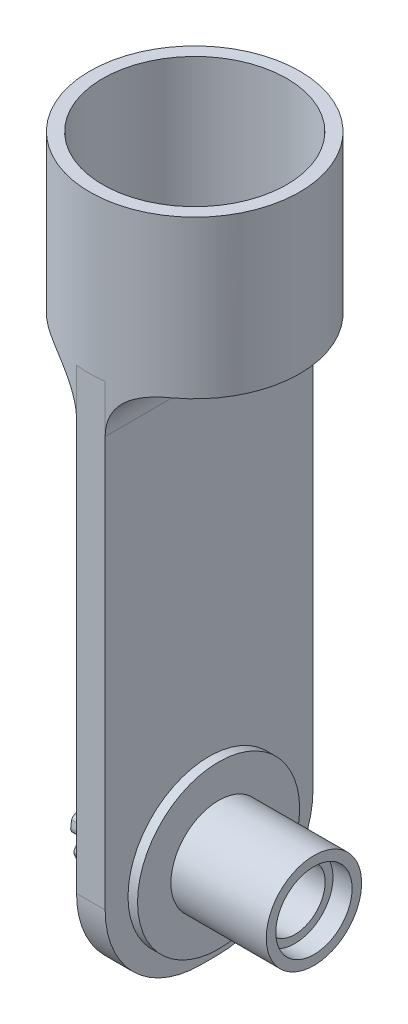
from build123d import *

# Parameters (mm, degrees)
SKETCH2_R                = 11
BOSS_EXTRUDE2_DEPTH      = 1.5
BOSS_EXTRUDE3_START      = -15
SKETCH3_R                = 11
SKETCH3_R_2              = 9.652
BOSS_EXTRUDE3_DEPTH      = 15
SKETCH4_W                = 3
SKETCH4_H                = 21.794494718
BOSS_EXTRUDE4_DEPTH      = 58
SKETCH11_R               = 8.5
BOSS_EXTRUDE11_DEPTH     = 1
SKETCH8_R                = 5
BOSS_EXTRUDE6_DEPTH      = 10
BOSS_EXTRUDE9_START      = 1
SKETCH17_R               = 8.5
BOSS_EXTRUDE9_DEPTH      = 1
SKETCH19_R               = 5.775
BOSS_EXTRUDE10_DEPTH     = 4.75
CUT_EXTRUDE5_DEPTH       = 4.75
FILLET3_R                = 0.5
CIRPATTERN2_COUNT        = 11
FILLET3_OF_CIRPATTERN2_R = 0.5
SKETCH15_R               = 3.175
ENCODER_BED_DEPTH        = 6
FILLET5_R                = 10
FILLET7_R                = 5
SKETCH21_R               = 4
CUT_EXTRUDE6_DEPTH       = 2


with BuildPart() as part:
    # Sketch2 → Boss-Extrude2 (new body)
    with BuildSketch(Plane(origin=(0, 0, 0), x_dir=(-1, 0, 0), z_dir=(0, 1, 0))):
        with Locations(Location((0, 0, 0), (0, 0, 90))):
            Circle(SKETCH2_R)
    extrude(amount=-BOSS_EXTRUDE2_DEPTH)

    # Sketch3 → Boss-Extrude3 (add)
    with BuildSketch(Plane(origin=(0, 0, 0), x_dir=(-1, 0, 0), z_dir=(0, -1, 0)).offset(BOSS_EXTRUDE3_START)):
        with Locations(Location((0, 0, 0), (0, 0, 270))):
            Circle(SKETCH3_R)
        with Locations(Location((0, 0, 0), (0, 0, 90))):
            Circle(SKETCH3_R_2, mode=Mode.SUBTRACT)
    extrude(amount=BOSS_EXTRUDE3_DEPTH)

    # Sketch4 → Boss-Extrude4 (add)
    with BuildSketch(Plane.XZ.offset(1.5)):
        Rectangle(SKETCH4_W, SKETCH4_H)
    extrude(amount=BOSS_EXTRUDE4_DEPTH)

    # Sketch11 → Boss-Extrude11 (add)
    with BuildSketch(Plane(origin=(1.5, 0, 0), x_dir=(0, 0, -1), z_dir=(1, 0, 0))):
        with Locations(Location((0, -49.5, 0), (0, 0, 180))):
            Circle(SKETCH11_R)
    extrude(amount=BOSS_EXTRUDE11_DEPTH)

    # Sketch8 → Boss-Extrude6 (add)
    with BuildSketch(Plane.ZY.offset(-2.5)):
        with Locations((0, -49.5)):
            Circle(SKETCH8_R)
    extrude(amount=-BOSS_EXTRUDE6_DEPTH)

    # Sketch17 → Boss-Extrude9 (add)
    with BuildSketch(Plane.ZY.offset(1.5).offset(BOSS_EXTRUDE9_START)):
        with Locations((0, -49.5)):
            Circle(SKETCH17_R)
    extrude(amount=-BOSS_EXTRUDE9_DEPTH)

    # Sketch19 → Boss-Extrude10 (add)
    with BuildSketch(Plane.ZY.offset(2.5)):
        with Locations((0, -49.5)):
            Circle(SKETCH19_R)
    extrude(amount=BOSS_EXTRUDE10_DEPTH)

    # Sketch14 → Cut-Extrude5 (cut)
    with BuildSketch(Plane.ZY.offset(2.5)):
        with BuildLine():
            Line((-0.25, -44.539224552), (-1, -43.812239017))
            ThreePointArc((-1, -43.812239017), (0, -43.725), (1, -43.812239017))
            Line((1, -43.812239017), (0.25, -44.539224552))
            ThreePointArc((0.25, -44.539224552), (0, -44.532929128), (-0.25, -44.539224552))
        make_face()
    cut_extrude5 = extrude(amount=CUT_EXTRUDE5_DEPTH, mode=Mode.SUBTRACT)

    # Fillet3
    # the kernel refuses this fillet: 0.5 mm, written as the material it adds along each edge
    with BuildSketch(Plane(origin=(-1.971938713, -44.539224552, -0.25), x_dir=(0, 0.030079948126667946, 0.9995474959804046), z_dir=(-1, 0, 0))) as fillet3_piece_1:
        with BuildLine():
            CenterArc((0.211467449, 0.499897303), FILLET3_R, 224.168999479, 44.669714596)
            Line((-0.147176406, 0.151508749), (0, 0))
            ThreePointArc((0, 0), (0.100667006, 0.001020208), (0.201334012, 0))
        make_face()
    extrude(amount=5.278061287)
    with BuildSketch(Plane(origin=(-1.971938713, -44.539224552, 0.25), x_dir=(0, 0.696004116807963, 0.7180377910572447), z_dir=(-1, 0, 0))) as fillet3_piece_2:
        with BuildLine():
            CenterArc((0.211224515, 0.5), FILLET3_R, 225.330285404, 44.669714596)
            ThreePointArc((-0.14028493, 0.144414413), (-0.069410683, 0.072918064), (0, 0))
            Line((0, 0), (0.211224515, 0))
        make_face()
    extrude(amount=5.278061287)
    # the kernel refuses this fillet: 0.5 mm, written as the material it takes off along each edge
    with BuildSketch(Plane(origin=(-2.5, -43.812239017, 1), x_dir=(0, -0.196537958792603, 0.9804962165932294), z_dir=(-1, 0, 0))) as fillet3_2_piece_1:
        with BuildLine():
            CenterArc((0.262836385, -0.499858535), FILLET3_R, 88.637028418, 56.804838909)
            Line((-0.148939157, -0.216237481), (0, 0))
            ThreePointArc((0, 0), (0.137364717, 0.001633916), (0.274729434, 0))
        make_face()
    extrude(amount=5.436823586, mode=Mode.SUBTRACT)
    with BuildSketch(Plane(origin=(-2.5, -43.812239017, -1), x_dir=(0, -0.19653795879262614, -0.9804962165932248), z_dir=(-1, 0, 0))) as fillet3_2_piece_2:
        with BuildLine():
            CenterArc((0.262836385, 0.499858535), FILLET3_R, 214.558132673, 56.804838909)
            Line((-0.148939157, 0.216237481), (0, 0))
            ThreePointArc((0, 0), (0.137364717, -0.001633916), (0.274729434, 0))
        make_face()
    extrude(amount=5.436823586, mode=Mode.SUBTRACT)

    # CirPattern2: Cut-Extrude5 ×11 about axis
    cirpattern2_axis = Axis((0, -49.5, 0), (1, 0, 0))
    for i in range(1, CIRPATTERN2_COUNT):
        add(cut_extrude5.rotate(cirpattern2_axis, i * 360 / CIRPATTERN2_COUNT), mode=Mode.SUBTRACT)

    # Fillet3 of CirPattern2
    # the kernel refuses this fillet: 0.5 mm, written as the material it adds along each edge
    with BuildSketch(Plane(origin=(-1.971938713, -45.191569924, 2.47168431), x_dir=(0, -0.5150913126835993, 0.8571353099703024), z_dir=(-1, 0, 0)), Plane(origin=(-1.971938713, -47.211811404, 4.408626316), x_dir=(0, -0.8967247211781322, 0.4425887192733241), z_dir=(-1, 0, 0)), Plane(origin=(-1.971938713, -49.958536595, 4.945860616), x_dir=(0, -0.9936543666527162, -0.11247666261047053), z_dir=(-1, 0, 0)), Plane(origin=(-1.971938713, -52.559679657, 3.912819117), x_dir=(0, -0.7751057715413291, -0.6318314988375626), z_dir=(-1, 0, 0)), Plane(origin=(-1.971938713, -54.189396047, 1.637485194), x_dir=(0, -0.3104665706012394, -0.9505842984917781), z_dir=(-1, 0, 0)), Plane(origin=(-1.971938713, -54.330262325, -1.157738708), x_dir=(0, 0.25274357285277954, -0.9675332998825475), z_dir=(-1, 0, 0)), Plane(origin=(-1.971938713, -52.937554444, -3.58538875), x_dir=(0, 0.7357094177267968, -0.6772973148242193), z_dir=(-1, 0, 0)), Plane(origin=(-1.971938713, -50.453447316, -4.874703197), x_dir=(0, 0.9850927207468828, -0.17202421786336916), z_dir=(-1, 0, 0)), Plane(origin=(-1.971938713, -47.666627402, -4.616333823), x_dir=(0, 0.9217160452624082, 0.38786535280407075), z_dir=(-1, 0, 0)), Plane(origin=(-1.971938713, -45.461890333, -2.892311077), x_dir=(0, 0.5657010379414769, 0.8246104144818546), z_dir=(-1, 0, 0))) as fillet3_of_cirpattern2_piece_1:
        with BuildLine():
            CenterArc((0.211467449, 0.499897303), FILLET3_OF_CIRPATTERN2_R, 224.168999479, 44.669714596)
            Line((-0.147176406, 0.151508749), (0, 0))
            ThreePointArc((0, 0), (0.100667006, 0.001020208), (0.201334012, 0))
        make_face()
    extrude(amount=5.278061287)
    with BuildSketch(Plane(origin=(-1.971938713, -45.461890333, 2.892311077), x_dir=(0, 0.1973153838085828, 0.9803400630967153), z_dir=(-1, 0, 0)), Plane(origin=(-1.971938713, -47.666627402, 4.616333823), x_dir=(0, -0.36401958938618195, 0.9313912918548871), z_dir=(-1, 0, 0)), Plane(origin=(-1.971938713, -50.453447316, 4.874703197), x_dir=(0, -0.8097809149903406, 0.5867323663455143), z_dir=(-1, 0, 0)), Plane(origin=(-1.971938713, -52.937554444, 3.58538875), x_dir=(0, -0.9984425217235857, 0.05579006017425312), z_dir=(-1, 0, 0)), Plane(origin=(-1.971938713, -54.330262325, 1.157738708), x_dir=(0, -0.8701056824673506, -0.4928651959086032), z_dir=(-1, 0, 0)), Plane(origin=(-1.971938713, -54.189396047, -1.637485194), x_dir=(0, -0.46551643690069133, -0.8850392347095605), z_dir=(-1, 0, 0)), Plane(origin=(-1.971938713, -52.559679657, -3.912819117), x_dir=(0, 0.08687098819994768, -0.996219569878631), z_dir=(-1, 0, 0)), Plane(origin=(-1.971938713, -49.958536595, -4.945860616), x_dir=(0, 0.611677488348186, -0.7911072305623649), z_dir=(-1, 0, 0)), Plane(origin=(-1.971938713, -47.211811404, -4.408626316), x_dir=(0, 0.9422807078524913, -0.33482393523911624), z_dir=(-1, 0, 0)), Plane(origin=(-1.971938713, -45.191569924, -2.47168431), x_dir=(0, 0.9737164604509508, 0.22776359376966263), z_dir=(-1, 0, 0))) as fillet3_of_cirpattern2_piece_2:
        with BuildLine():
            CenterArc((0.211224515, 0.5), FILLET3_OF_CIRPATTERN2_R, 225.330285404, 44.669714596)
            ThreePointArc((-0.14028493, 0.144414413), (-0.069410683, 0.072918064), (0, 0))
            Line((0, 0), (0.211224515, 0))
        make_face()
    extrude(amount=5.278061287)
    # the kernel refuses this fillet: 0.5 mm, written as the material it takes off along each edge
    with BuildSketch(Plane(origin=(-2.5, -45.255791797, 3.91628928), x_dir=(0, -0.19731538380856273, -0.9803400630967192), z_dir=(-1, 0, 0)), Plane(origin=(-2.5, -48.046850693, 5.589184385), x_dir=(0, 0.3640195893861915, -0.9313912918548833), z_dir=(-1, 0, 0)), Plane(origin=(-2.5, -51.299274226, 5.487552939), x_dir=(0, 0.8097809149903348, -0.5867323663455221), z_dir=(-1, 0, 0)), Plane(origin=(-2.5, -53.980440906, 3.643662208), x_dir=(0, 0.9984425217235859, -0.05579006017425271), z_dir=(-1, 0, 0)), Plane(origin=(-2.5, -55.239099256, 0.642934471), x_dir=(0, 0.8701056824673439, 0.49286519590861544), z_dir=(-1, 0, 0)), Plane(origin=(-2.5, -54.675634142, -2.561920418), x_dir=(0, 0.4655164369006978, 0.8850392347095573), z_dir=(-1, 0, 0)), Plane(origin=(-2.5, -52.468941757, -4.953383676), x_dir=(0, -0.086870988199948, 0.996219569878631), z_dir=(-1, 0, 0)), Plane(origin=(-2.5, -49.319631343, -5.772182616), x_dir=(0, -0.6116774883481947, 0.7911072305623583), z_dir=(-1, 0, 0)), Plane(origin=(-2.5, -46.227586702, -4.758354359), x_dir=(0, -0.9422807078524913, 0.33482393523911663), z_dir=(-1, 0, 0)), Plane(origin=(-2.5, -44.174510162, -2.233782215), x_dir=(0, -0.9737164604509494, -0.22776359376966787), z_dir=(-1, 0, 0))) as fillet3_of_cirpattern2_2_piece_1:
        with BuildLine():
            CenterArc((0.262567174, 0.5), FILLET3_OF_CIRPATTERN2_R, 213.195161091, 56.804838909)
            ThreePointArc((-0.155838104, 0.226253724), (-0.079264666, 0.112200036), (0, 0))
            Line((0, 0), (0.262567174, 0))
        make_face()
    extrude(amount=5.436823586, mode=Mode.SUBTRACT)
    with BuildSketch(Plane(origin=(-2.5, -44.174510162, 2.233782215), x_dir=(0, 0.3647580238813835, -0.9311023488393465), z_dir=(-1, 0, 0)), Plane(origin=(-2.5, -46.227586702, 4.758354359), x_dir=(0, 0.8102459112300486, -0.5860900641838148), z_dir=(-1, 0, 0)), Plane(origin=(-2.5, -49.319631343, 5.772182616), x_dir=(0, 0.9984864466872424, -0.05499832526436153), z_dir=(-1, 0, 0)), Plane(origin=(-2.5, -52.468941757, 4.953383676), x_dir=(0, 0.869714590289287, 0.49355499332692165), z_dir=(-1, 0, 0)), Plane(origin=(-2.5, -54.675634142, 2.561920418), x_dir=(0, 0.4648144965841362, 0.8854080888297982), z_dir=(-1, 0, 0)), Plane(origin=(-2.5, -55.239099256, -0.642934471), x_dir=(0, -0.08766091556420891, 0.9961503721238298), z_dir=(-1, 0, 0)), Plane(origin=(-2.5, -53.980440906, -3.643662208), x_dir=(0, -0.61230460640333, 0.790621950730729), z_dir=(-1, 0, 0)), Plane(origin=(-2.5, -51.299274226, -5.487552939), x_dir=(0, -0.9425459110470017, 0.3340766462483984), z_dir=(-1, 0, 0)), Plane(origin=(-2.5, -48.046850693, -5.589184385), x_dir=(0, -0.9735355486444339, -0.22853563294501988), z_dir=(-1, 0, 0)), Plane(origin=(-2.5, -45.255791797, -3.91628928), x_dir=(0, -0.6954345282207983, -0.7185894634339663), z_dir=(-1, 0, 0))) as fillet3_of_cirpattern2_2_piece_2:
        with BuildLine():
            CenterArc((0.262836385, 0.499858535), FILLET3_OF_CIRPATTERN2_R, 214.558132673, 56.804838909)
            Line((-0.148939157, 0.216237481), (0, 0))
            ThreePointArc((0, 0), (0.137364717, -0.001633916), (0.274729434, 0))
        make_face()
    extrude(amount=5.436823586, mode=Mode.SUBTRACT)

    # Sketch15 → encoder_bed (cut)
    with BuildSketch(Plane(origin=(12.5, 0, 0), x_dir=(0, 0, -1), z_dir=(1, 0, 0))):
        with Locations((0, -49.5)):
            Circle(SKETCH15_R)
    extrude(amount=-ENCODER_BED_DEPTH, mode=Mode.SUBTRACT)

    # Fillet5
    fillet5_edges = [part.edges().sort_by_distance(p)[0] for p in [
        (0, -59.5, 10.897247359),
        (0, -59.5, -10.897247359),
    ]]
    fillet(fillet5_edges, radius=FILLET5_R)

    # Fillet7
    # the kernel refuses this fillet: 5 mm, written as the material it adds along each edge
    with BuildSketch(Plane(origin=(1.5, -1.5, 10.897247359), x_dir=(0, -1, 0), z_dir=(0, 0, -1))) as fillet7_piece_1_section:
        with BuildLine():
            CenterArc((FILLET7_R, -FILLET7_R), FILLET7_R, 90, 90)
            Line((0, -FILLET7_R), (0, 0))
            Line((0, 0), (FILLET7_R, 0))
        make_face()
    fillet7_piece_1 = extrude(amount=21.794494718, mode=Mode.PRIVATE)
    fillet7_piece_1 = fillet7_piece_1 & Plane(origin=(0, -2.650343277, 0), x_dir=(0, 0, 1), z_dir=(0, 1, 0)) * Cylinder(11, 64, mode=Mode.PRIVATE)
    add(fillet7_piece_1)
    with BuildSketch(Plane(origin=(-1.5, -1.5, -10.897247359), x_dir=(0, -1, 0), z_dir=(0, 0, 1))) as fillet7_piece_2_section:
        with BuildLine():
            CenterArc((FILLET7_R, -FILLET7_R), FILLET7_R, 90, 90)
            Line((0, -FILLET7_R), (0, 0))
            Line((0, 0), (FILLET7_R, 0))
        make_face()
    fillet7_piece_2 = extrude(amount=21.794494718, mode=Mode.PRIVATE)
    fillet7_piece_2 = fillet7_piece_2 & Plane(origin=(0, -2.650343277, 0), x_dir=(0, 0, 1), z_dir=(0, 1, 0)) * Cylinder(11, 64, mode=Mode.PRIVATE)
    add(fillet7_piece_2)

    # Sketch21 → Cut-Extrude6 (cut)
    with BuildSketch(Plane(origin=(12.5, 0, 0), x_dir=(0, 0, -1), z_dir=(1, 0, 0))):
        with Locations((0, -49.5)):
            Circle(SKETCH21_R)
    extrude(amount=-CUT_EXTRUDE6_DEPTH, mode=Mode.SUBTRACT)


solid = part.part
